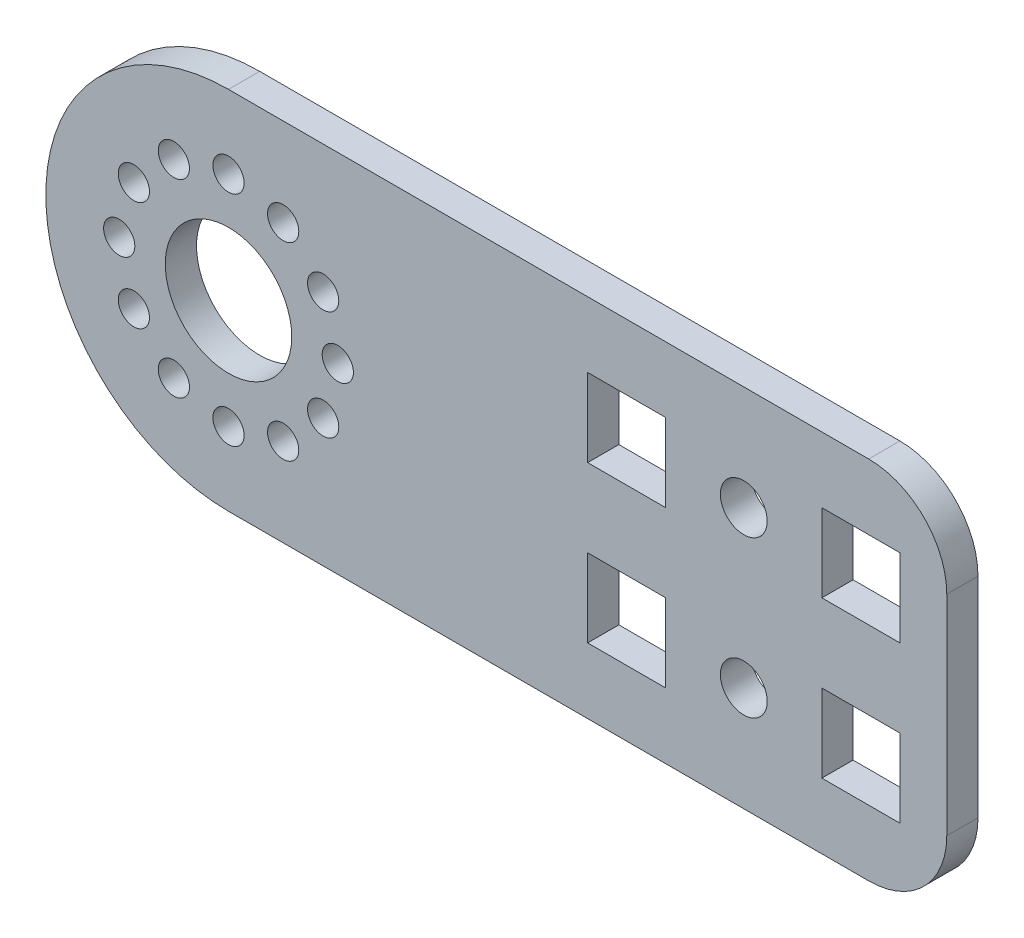
from build123d import *

# Parameters (mm, degrees)
BOSS_EXTRUDE1_OUTLINE_R   = 1
BOSS_EXTRUDE1_OUTLINE_W   = 5
BOSS_EXTRUDE1_OUTLINE_H   = 5
BOSS_EXTRUDE1_OUTLINE_R_2 = 1.5
BOSS_EXTRUDE1_OUTLINE_R_3 = 4.05
BOSS_EXTRUDE1_DEPTH       = 2
CONG_1_R                  = 5


# Read off the part's stored shape, not the designer's step: Boss-Extrude1
with BuildPart() as part:
    # Boss-Extrude1 outline → Boss-Extrude1 (new body)
    with BuildSketch(Plane.XY):
        with BuildLine():
            Line((46, -11.7), (46, 11.7))
            Line((46, 11.7), (0, 11.7))
            ThreePointArc((0, 11.7), (-11.7, 0), (0, -11.7))
            Line((0, -11.7), (46, -11.7))
        make_face()
        with Locations((-3.5, -6.062177826)):
            Circle(BOSS_EXTRUDE1_OUTLINE_R, mode=Mode.SUBTRACT)
        with Locations((0, -7)):
            Circle(BOSS_EXTRUDE1_OUTLINE_R, mode=Mode.SUBTRACT)
        with Locations((3.5, -6.062177826)):
            Circle(BOSS_EXTRUDE1_OUTLINE_R, mode=Mode.SUBTRACT)
        with Locations((-6.062177826, -3.5)):
            Circle(BOSS_EXTRUDE1_OUTLINE_R, mode=Mode.SUBTRACT)
        with Locations((6.062177826, -3.5)):
            Circle(BOSS_EXTRUDE1_OUTLINE_R, mode=Mode.SUBTRACT)
        with Locations((25.5, -5)):
            Rectangle(BOSS_EXTRUDE1_OUTLINE_W, BOSS_EXTRUDE1_OUTLINE_H, mode=Mode.SUBTRACT)
        with Locations((33, -5)):
            Circle(BOSS_EXTRUDE1_OUTLINE_R_2, mode=Mode.SUBTRACT)
        with Locations((40.5, -5)):
            Rectangle(BOSS_EXTRUDE1_OUTLINE_W, BOSS_EXTRUDE1_OUTLINE_H, mode=Mode.SUBTRACT)
        with Locations((-7, 0)):
            Circle(BOSS_EXTRUDE1_OUTLINE_R, mode=Mode.SUBTRACT)
        Circle(BOSS_EXTRUDE1_OUTLINE_R_3, mode=Mode.SUBTRACT)
        with Locations((-6.062177826, 3.5)):
            Circle(BOSS_EXTRUDE1_OUTLINE_R, mode=Mode.SUBTRACT)
        with Locations((7, 0)):
            Circle(BOSS_EXTRUDE1_OUTLINE_R, mode=Mode.SUBTRACT)
        with Locations((6.062177826, 3.5)):
            Circle(BOSS_EXTRUDE1_OUTLINE_R, mode=Mode.SUBTRACT)
        with Locations((-3.5, 6.062177826)):
            Circle(BOSS_EXTRUDE1_OUTLINE_R, mode=Mode.SUBTRACT)
        with Locations((0, 7)):
            Circle(BOSS_EXTRUDE1_OUTLINE_R, mode=Mode.SUBTRACT)
        with Locations((3.5, 6.062177826)):
            Circle(BOSS_EXTRUDE1_OUTLINE_R, mode=Mode.SUBTRACT)
        with Locations((25.5, 5)):
            Rectangle(BOSS_EXTRUDE1_OUTLINE_W, BOSS_EXTRUDE1_OUTLINE_H, mode=Mode.SUBTRACT)
        with Locations((33, 5)):
            Circle(BOSS_EXTRUDE1_OUTLINE_R_2, mode=Mode.SUBTRACT)
        with Locations((40.5, 5)):
            Rectangle(BOSS_EXTRUDE1_OUTLINE_W, BOSS_EXTRUDE1_OUTLINE_H, mode=Mode.SUBTRACT)
    extrude(amount=BOSS_EXTRUDE1_DEPTH)

    # Congé1
    cong_1_edges = [part.edges().sort_by_distance(p)[0] for p in [
        (46, 11.7, 1),
        (46, -11.7, 1),
    ]]
    fillet(cong_1_edges, radius=CONG_1_R)


solid = part.part
